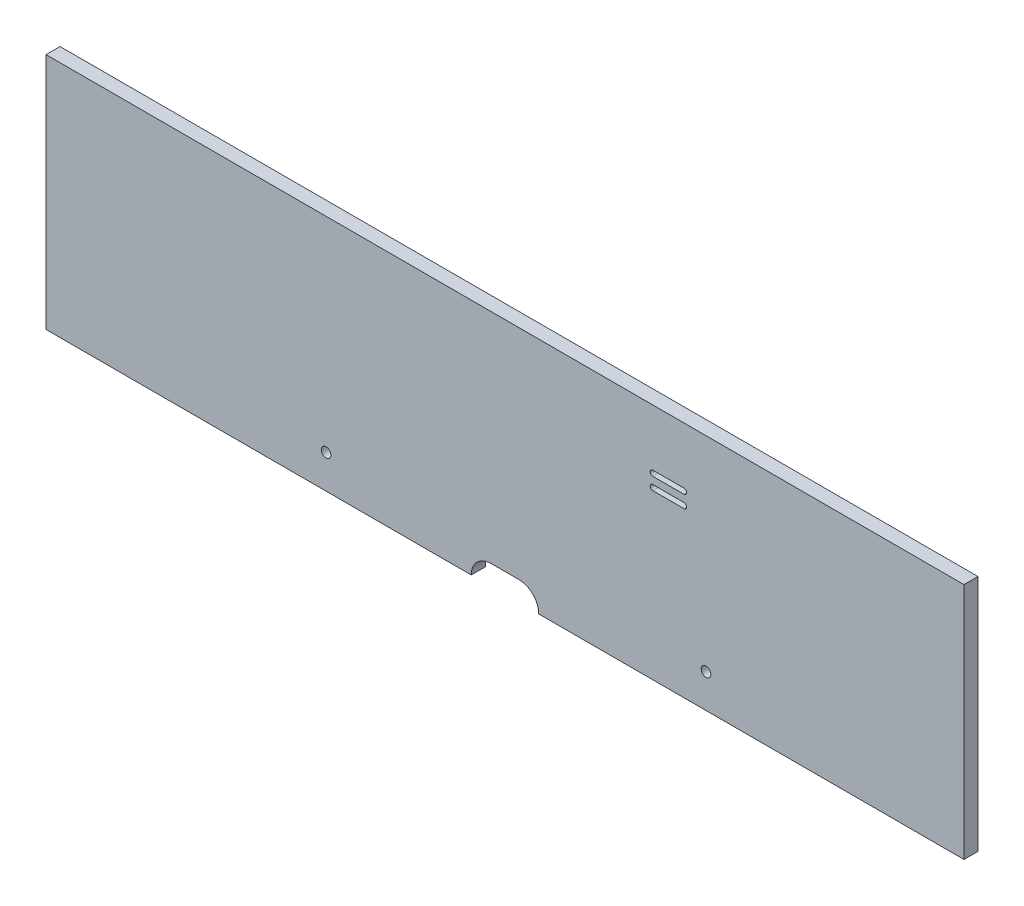
from build123d import *

# Parameters (mm, degrees)
SKETCH1_W           = 295
SKETCH1_H           = 76.5
BOSS_EXTRUDE1_DEPTH = 4.5
CUT_EXTRUDE1_REACH  = 154.445
SKETCH3_R           = 1.55
CUT_EXTRUDE2_DEPTH  = 14
CUT_EXTRUDE3_DEPTH  = 8


with BuildPart() as part:
    # Sketch1 → Boss-Extrude1 (new body)
    with BuildSketch(Plane.XY):
        Rectangle(SKETCH1_W, SKETCH1_H)
    extrude(amount=BOSS_EXTRUDE1_DEPTH)

    # Sketch2 → Cut-Extrude1 (cut, up to next)
    with BuildSketch(Plane.XY.offset(4.5), mode=Mode.PRIVATE) as cut_extrude1_sk1:
        with BuildLine():
            Line((4.467819604, -44.629426527), (-4.467819604, -44.629426527))
            ThreePointArc((-4.467819604, -44.629426527), (-10.847246131, -38.25), (-4.467819604, -31.870573473))
            Line((-4.467819604, -31.870573473), (4.467819604, -31.870573473))
            ThreePointArc((4.467819604, -31.870573473), (10.847246131, -38.25), (4.467819604, -44.629426527))
        make_face()
    cut_extrude1_tool1 = extrude(cut_extrude1_sk1.sketch, amount=-CUT_EXTRUDE1_REACH, mode=Mode.PRIVATE) & part.part
    add(cut_extrude1_tool1.solids().sort_by_distance((0, -38.25, 4.5))[0], mode=Mode.SUBTRACT)

    # Sketch3 → Cut-Extrude2 (cut)
    with BuildSketch(Plane.XY.offset(4.5)):
        with Locations((64.6, -27.45)):
            Circle(SKETCH3_R)
        with Locations((-57.5, -27.45)):
            Circle(SKETCH3_R)
    extrude(amount=-CUT_EXTRUDE2_DEPTH, mode=Mode.SUBTRACT)

    # Sketch4 → Cut-Extrude3 (cut)
    with BuildSketch(Plane.XY.offset(4.5)):
        with BuildLine():
            Line((57.5, 14.4), (47.5, 14.4))
            ThreePointArc((47.5, 14.4), (46.65, 15.25), (47.5, 16.1))
            Line((47.5, 16.1), (57.5, 16.1))
            ThreePointArc((57.5, 16.1), (58.35, 15.25), (57.5, 14.4))
        make_face()
        with BuildLine():
            Line((57.5, 18.4), (47.5, 18.4))
            ThreePointArc((47.5, 18.4), (46.65, 19.25), (47.5, 20.1))
            Line((47.5, 20.1), (57.5, 20.1))
            ThreePointArc((57.5, 20.1), (58.35, 19.25), (57.5, 18.4))
        make_face()
    extrude(amount=-CUT_EXTRUDE3_DEPTH, mode=Mode.SUBTRACT)


solid = part.part
